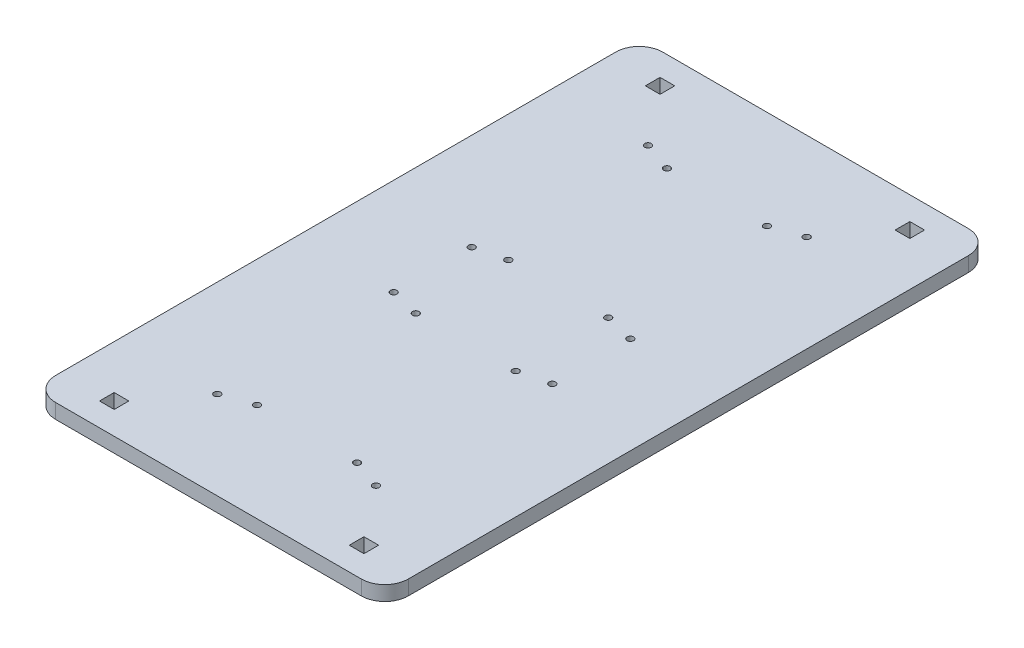
from build123d import *

# Parameters (mm, degrees)
SKETCH3_W           = 152.4
SKETCH3_H           = 262.339276313
SKETCH3_R           = 1.4224
SKETCH3_W_2         = 6.35
SKETCH3_H_2         = 6.35
BOSS_EXTRUDE1_DEPTH = 6.35
FILLET1_R           = 10.16


with BuildPart() as part:
    # Sketch3 → Boss-Extrude1 (new body)
    with BuildSketch(Plane(origin=(0, 0, 0), x_dir=(1, 0, 0), z_dir=(0, 1, 0))):
        with Locations((76.2, 131.169638157)):
            Rectangle(SKETCH3_W, SKETCH3_H)
        with Locations((41.91, 38.1)):
            Circle(SKETCH3_R, mode=Mode.SUBTRACT)
        with Locations((41.91, 114.3)):
            Circle(SKETCH3_R, mode=Mode.SUBTRACT)
        with Locations((110.49, 114.3)):
            Circle(SKETCH3_R, mode=Mode.SUBTRACT)
        with Locations((110.49, 38.1)):
            Circle(SKETCH3_R, mode=Mode.SUBTRACT)
        with Locations((54.61, 151.157668748)):
            Circle(SKETCH3_R, mode=Mode.SUBTRACT)
        with Locations((54.61, 219.737668748)):
            Circle(SKETCH3_R, mode=Mode.SUBTRACT)
        with Locations((97.79, 151.157668748)):
            Circle(SKETCH3_R, mode=Mode.SUBTRACT)
        with Locations((97.79, 219.737668748)):
            Circle(SKETCH3_R, mode=Mode.SUBTRACT)
        with Locations((97.79, 42.601607565)):
            Circle(SKETCH3_R, mode=Mode.SUBTRACT)
        with Locations((97.79, 111.181607565)):
            Circle(SKETCH3_R, mode=Mode.SUBTRACT)
        with Locations((54.61, 111.181607565)):
            Circle(SKETCH3_R, mode=Mode.SUBTRACT)
        with Locations((54.61, 42.601607565)):
            Circle(SKETCH3_R, mode=Mode.SUBTRACT)
        with Locations((110.49, 148.039276313)):
            Circle(SKETCH3_R, mode=Mode.SUBTRACT)
        with Locations((110.49, 224.239276313)):
            Circle(SKETCH3_R, mode=Mode.SUBTRACT)
        with Locations((41.91, 224.239276313)):
            Circle(SKETCH3_R, mode=Mode.SUBTRACT)
        with Locations((41.91, 148.039276313)):
            Circle(SKETCH3_R, mode=Mode.SUBTRACT)
        with Locations((22.225, 13.212735966)):
            Rectangle(SKETCH3_W_2, SKETCH3_H_2, mode=Mode.SUBTRACT)
        with Locations((130.175, 13.212735966)):
            Rectangle(SKETCH3_W_2, SKETCH3_H_2, mode=Mode.SUBTRACT)
        with Locations((130.175, 249.126540348)):
            Rectangle(SKETCH3_W_2, SKETCH3_H_2, mode=Mode.SUBTRACT)
        with Locations((22.225, 249.126540348)):
            Rectangle(SKETCH3_W_2, SKETCH3_H_2, mode=Mode.SUBTRACT)
    extrude(amount=BOSS_EXTRUDE1_DEPTH)

    # Fillet1
    fillet1_edges = [part.edges().sort_by_distance(p)[0] for p in [
        (0, 3.175, 0),
        (0, 3.175, -262.339276313),
        (152.4, 3.175, 0),
        (152.4, 3.175, -262.339276313),
    ]]
    fillet(fillet1_edges, radius=FILLET1_R)


solid = part.part
